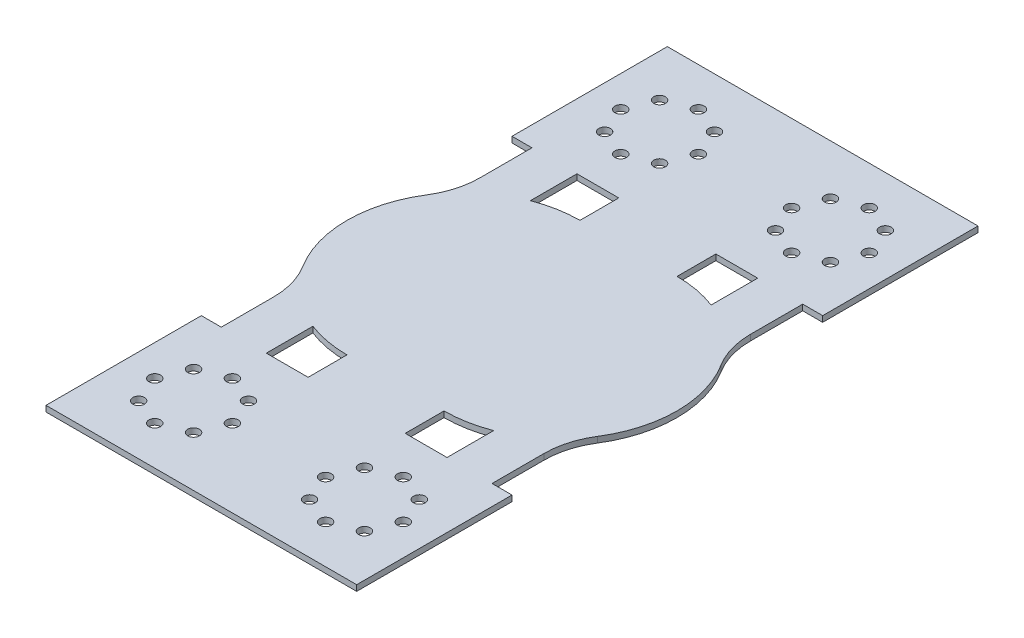
from build123d import *

# Parameters (mm, degrees)
SALIENTE_EXTRUIR1_DEPTH = 1.5
CROQUIS2_R              = 1.5
CORTAR_EXTRUIR1_DEPTH   = 1.5
REDONDEO1_R             = 20


with BuildPart() as part:
    # Croquis1 → Saliente-Extruir1 (new body)
    with BuildSketch(Plane(origin=(0, 0, 0), x_dir=(1, 0, 0), z_dir=(0, 1, 0))):
        with BuildLine():
            Line((-40, 0), (-40, -40))
            Line((-40, -40), (40, -40))
            Line((40, -40), (40, 0))
            Line((40, 0), (34.860679775, 0))
            Line((34.860679775, 0), (34.860679775, 20))
            ThreePointArc((34.860679775, 20), (42.5, 40), (34.860679775, 60))
            Line((34.860679775, 60), (34.860679775, 80))
            Line((34.860679775, 80), (40, 80))
            Line((40, 80), (40, 120))
            Line((40, 120), (-40, 120))
            Line((-40, 120), (-40, 80))
            Line((-40, 80), (-34.860679775, 80))
            Line((-34.860679775, 80), (-34.860679775, 60))
            ThreePointArc((-34.860679775, 60), (-42.5, 40), (-34.860679775, 20))
            Line((-34.860679775, 20), (-34.860679775, 0))
            Line((-34.860679775, 0), (-40, 0))
        make_face()
        with BuildLine():
            Line((-12.5, 0), (-23.270329614, 0))
            Line((-23.270329614, 0), (-23.270329614, 12))
            ThreePointArc((-23.270329614, 12), (-17.977225575, 10.504237592), (-12.5, 10))
            Line((-12.5, 10), (-12.5, 0))
        make_face(mode=Mode.SUBTRACT)
        with BuildLine():
            Line((-12.5, 80), (-12.5, 70))
            ThreePointArc((-12.5, 70), (-17.977225575, 69.495762408), (-23.270329614, 68))
            Line((-23.270329614, 68), (-23.270329614, 80))
            Line((-23.270329614, 80), (-12.5, 80))
        make_face(mode=Mode.SUBTRACT)
        with BuildLine():
            Line((12.5, 80), (23.270329614, 80))
            Line((23.270329614, 80), (23.270329614, 68))
            ThreePointArc((23.270329614, 68), (17.977225575, 69.495762408), (12.5, 70))
            Line((12.5, 70), (12.5, 80))
        make_face(mode=Mode.SUBTRACT)
        with BuildLine():
            Line((12.5, 0), (12.5, 10))
            ThreePointArc((12.5, 10), (17.977225575, 10.504237592), (23.270329614, 12))
            Line((23.270329614, 12), (23.270329614, 0))
            Line((23.270329614, 0), (12.5, 0))
        make_face(mode=Mode.SUBTRACT)
    extrude(amount=SALIENTE_EXTRUIR1_DEPTH)

    # Croquis2 → Cortar-Extruir1 (cut)
    with BuildSketch(Plane(origin=(0, 1.5, 0), x_dir=(1, 0, 0), z_dir=(0, 1, 0))):
        with Locations((32, -20)):
            Circle(CROQUIS2_R)
        with Locations((29.071067812, -27.071067812)):
            Circle(CROQUIS2_R)
        with Locations((22, -30)):
            Circle(CROQUIS2_R)
        with Locations((14.928932188, -27.071067812)):
            Circle(CROQUIS2_R)
        with Locations((12, -20)):
            Circle(CROQUIS2_R)
        with Locations((14.928932188, -12.928932188)):
            Circle(CROQUIS2_R)
        with Locations((22, -10)):
            Circle(CROQUIS2_R)
        with Locations((29.071067812, -12.928932188)):
            Circle(CROQUIS2_R)
        with Locations((-29.071067812, -12.928932188)):
            Circle(CROQUIS2_R)
        with Locations((-22, -10)):
            Circle(CROQUIS2_R)
        with Locations((-14.928932188, -12.928932188)):
            Circle(CROQUIS2_R)
        with Locations((-12, -20)):
            Circle(CROQUIS2_R)
        with Locations((-14.928932188, -27.071067812)):
            Circle(CROQUIS2_R)
        with Locations((-22, -30)):
            Circle(CROQUIS2_R)
        with Locations((-29.071067812, -27.071067812)):
            Circle(CROQUIS2_R)
        with Locations((-32, -20)):
            Circle(CROQUIS2_R)
        with Locations((-32, 100)):
            Circle(CROQUIS2_R)
        with Locations((-29.071067812, 107.071067812)):
            Circle(CROQUIS2_R)
        with Locations((-22, 110)):
            Circle(CROQUIS2_R)
        with Locations((-14.928932188, 107.071067812)):
            Circle(CROQUIS2_R)
        with Locations((-12, 100)):
            Circle(CROQUIS2_R)
        with Locations((-14.928932188, 92.928932188)):
            Circle(CROQUIS2_R)
        with Locations((-22, 90)):
            Circle(CROQUIS2_R)
        with Locations((-29.071067812, 92.928932188)):
            Circle(CROQUIS2_R)
        with Locations((29.071067812, 92.928932188)):
            Circle(CROQUIS2_R)
        with Locations((22, 90)):
            Circle(CROQUIS2_R)
        with Locations((14.928932188, 92.928932188)):
            Circle(CROQUIS2_R)
        with Locations((12, 100)):
            Circle(CROQUIS2_R)
        with Locations((14.928932188, 107.071067812)):
            Circle(CROQUIS2_R)
        with Locations((22, 110)):
            Circle(CROQUIS2_R)
        with Locations((29.071067812, 107.071067812)):
            Circle(CROQUIS2_R)
        with Locations((32, 100)):
            Circle(CROQUIS2_R)
    extrude(amount=-CORTAR_EXTRUIR1_DEPTH, mode=Mode.SUBTRACT)

    # Redondeo1
    redondeo1_edges = [part.edges().sort_by_distance(p)[0] for p in [
        (-34.860679775, 0.75, -60),
        (-34.860679775, 0.75, -20),
        (34.860679775, 0.75, -20),
        (34.860679775, 0.75, -60),
    ]]
    fillet(redondeo1_edges, radius=REDONDEO1_R)


solid = part.part
